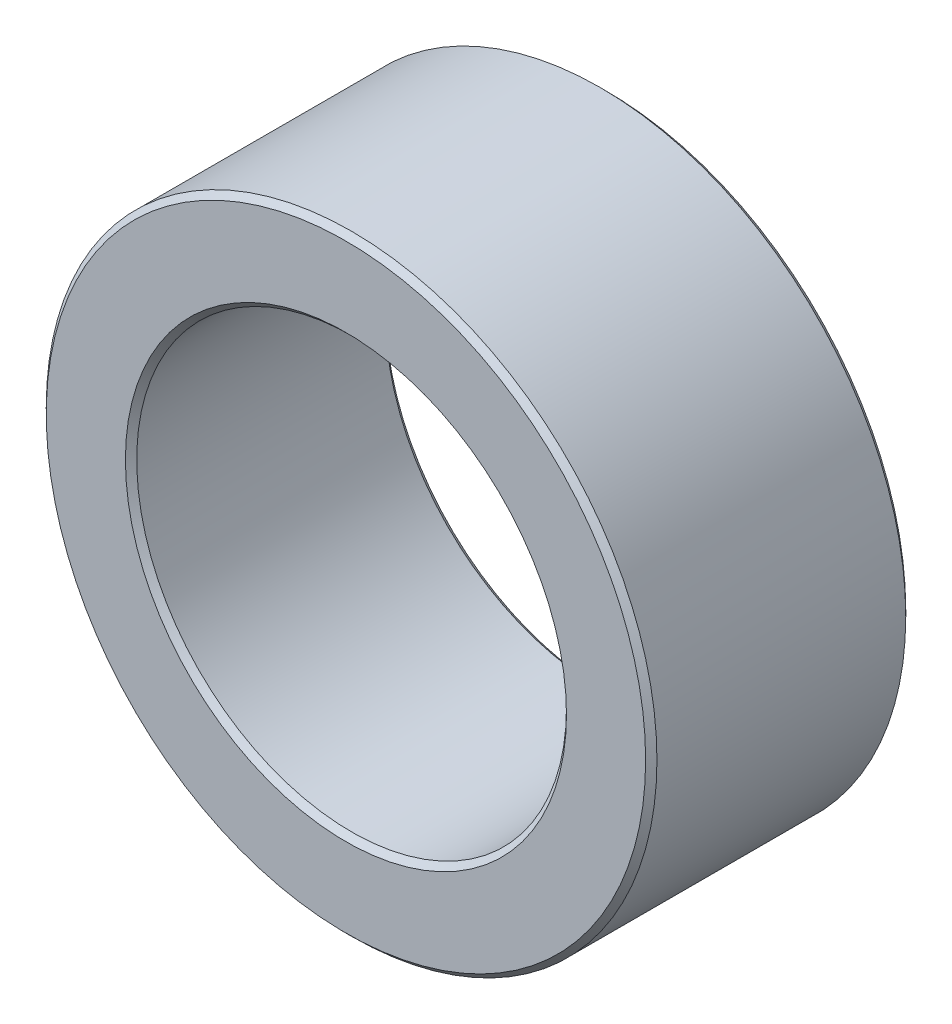
from build123d import *

# Parameters (mm, degrees)
SKIZZE1_R                       = 27
SKIZZE1_R_2                     = 19
AUFSATZ_LINEAR_AUSTRAGEN1_DEPTH = 11.5
FASE1_SIZE                      = 0.5


with BuildPart() as part:
    # Skizze1 → Aufsatz-Linear austragen1 (new, symmetric)
    with BuildSketch(Plane.XY):
        Circle(SKIZZE1_R)
        Circle(SKIZZE1_R_2, mode=Mode.SUBTRACT)
    extrude(amount=AUFSATZ_LINEAR_AUSTRAGEN1_DEPTH, both=True)

    # Fase1
    fase1_edges = [part.edges().sort_by_distance(p)[0] for p in [
        (-19, 0, -11.5),
        (-27, 0, -11.5),
        (-27, 0, 11.5),
        (-19, 0, 11.5),
    ]]
    chamfer(fase1_edges, length=FASE1_SIZE)


solid = part.part
